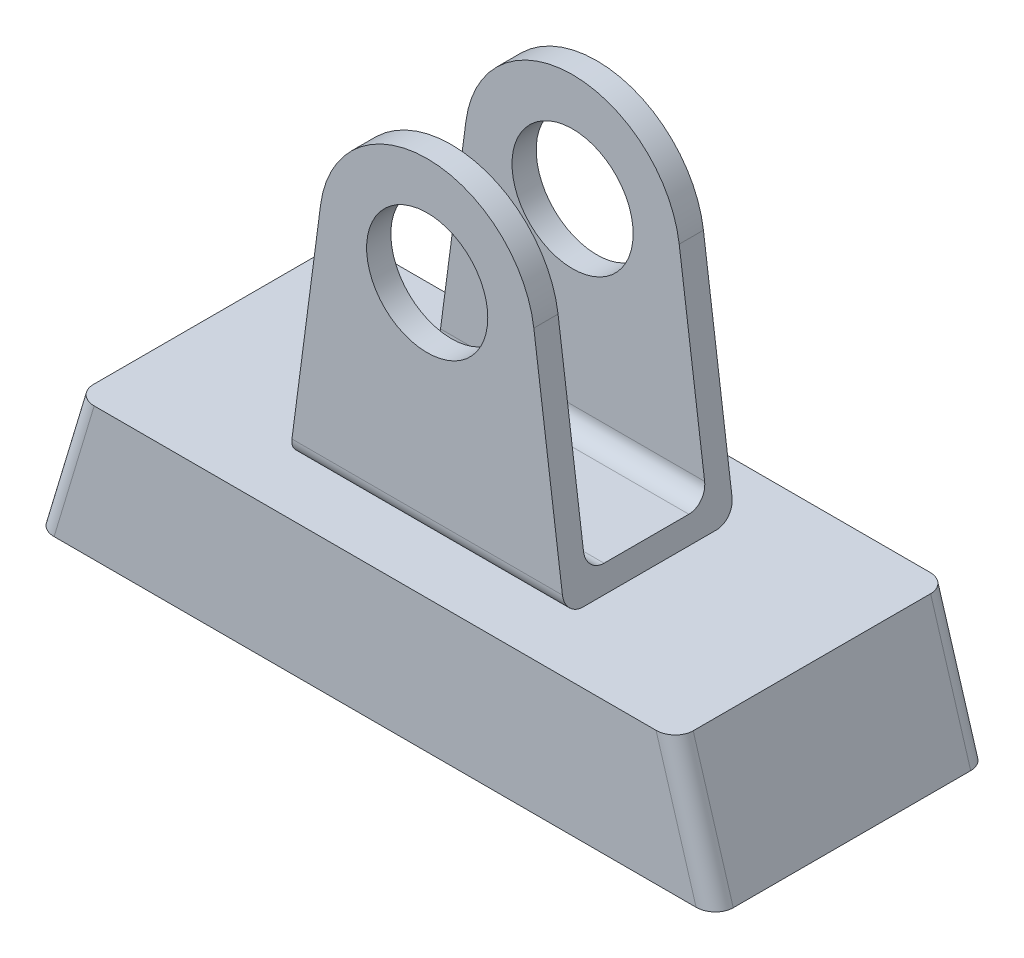
from build123d import *

# Parameters (mm, degrees)
SKETCH1_R           = 5
BOSS_EXTRUDE1_DEPTH = 2
BOSS_EXTRUDE2_DEPTH = 10
LPATTERN1_COUNT     = 2
LPATTERN1_PITCH     = 12
FILLET1_R           = 1.5
SKETCH3_W           = 56.126339002
SKETCH3_H           = 22.59818153
BOSS_EXTRUDE3_DEPTH = 11
CUT_EXTRUDE1_DEPTH  = 47.406488284
SHELL1_START        = -14.299090765
SHELL1_DEPTH        = 18.59818153
FILLET2_R           = 1.5
SKETCH6_W           = 1.5
SKETCH6_H           = 18.59818153
BOSS_EXTRUDE4_DEPTH = 2


# Read off the part's stored shape, not the designer's step: Shell1
with BuildPart() as part:
    # Sketch1 → Boss-Extrude1 (new body)
    with BuildSketch(Plane.XY):
        with BuildLine():
            Line((-11.361776574, -18.246245298), (-8.801388784, 1.161153468))
            ThreePointArc((-8.801388784, 1.161153468), (0, 8.87765295), (8.801388784, 1.161153468))
            Line((8.801388784, 1.161153468), (11.361776574, -18.246245298))
            Line((11.361776574, -18.246245298), (-11.361776574, -18.246245298))
        make_face()
        Circle(SKETCH1_R, mode=Mode.SUBTRACT)
    boss_extrude1 = extrude(amount=BOSS_EXTRUDE1_DEPTH)

    # Sketch2 → Boss-Extrude2 (add)
    with BuildSketch(Plane(origin=(0, 0, 0), x_dir=(-1, 0, 0), z_dir=(0, 0, -1))):
        Polygon((-11.0979197, -16.246245298), (11.0979197, -16.246245298), (11.361776574, -18.246245298), (-11.361776574, -18.246245298), align=None)
    extrude(amount=BOSS_EXTRUDE2_DEPTH)

    # LPattern1: Boss-Extrude1 ×2
    with Locations(*[(0, 0, -i * LPATTERN1_PITCH) for i in range(1, LPATTERN1_COUNT)]):
        add(boss_extrude1)

    # Fillet1
    fillet1_edges = [part.edges().sort_by_distance(p)[0] for p in [
        (0, -18.246245298, -12),
        (0, -16.246245298, 0),
        (0, -16.246245298, -10),
        (0, -18.246245298, 2),
    ]]
    fillet(fillet1_edges, radius=FILLET1_R)

    # Sketch3 → Boss-Extrude3 (add)
    with BuildSketch(Plane.XZ.offset(18.246245298)):
        with Locations((0, -5)):
            Rectangle(SKETCH3_W, SKETCH3_H)
    extrude(amount=BOSS_EXTRUDE3_DEPTH)

    # Sketch5 → Cut-Extrude1 (cut, through all)
    with BuildSketch(Plane.XY.offset(6.299090765)):
        Polygon((-28.063169501, -29.246245298), (-24.755567795, -18.246245298), (-28.063169501, -18.246245298), align=None)
        Polygon((28.063169501, -18.246245298), (28.063169501, -29.246245298), (24.755567795, -18.246245298), align=None)
    extrude(amount=-CUT_EXTRUDE1_DEPTH, mode=Mode.SUBTRACT)

    # Shell1 outline → Shell1 (cut)
    with BuildSketch(Plane.XY.offset(SHELL1_START)):
        Polygon((25.974710628, -29.246245298), (25.674019564, -28.246245298), (-25.674019564, -28.246245298), (-25.974710628, -29.246245298), align=None)
    extrude(amount=SHELL1_DEPTH, mode=Mode.SUBTRACT)

    # Fillet2
    fillet2_edges = [part.edges().sort_by_distance(p)[0] for p in [
        (26.409368648, -23.746245298, -16.299090765),
        (26.409368648, -23.746245298, 6.299090765),
        (25.824365096, -28.746245298, -14.299090765),
        (-25.824365096, -28.746245298, -14.299090765),
        (-25.824365096, -28.746245298, 4.299090765),
        (25.824365096, -28.746245298, 4.299090765),
        (-26.409368648, -23.746245298, -16.299090765),
        (-26.409368648, -23.746245298, 6.299090765),
    ]]
    fillet(fillet2_edges, radius=FILLET2_R)

    # Sketch6 → Boss-Extrude4 (add)
    with BuildSketch(Plane.XZ.offset(28.246245298)):
        with Locations((23.658366473, -5)):
            Rectangle(SKETCH6_W, SKETCH6_H)
        with Locations((20.038366473, -5)):
            Rectangle(SKETCH6_W, SKETCH6_H)
        with Locations((16.418366473, -5)):
            Rectangle(SKETCH6_W, SKETCH6_H)
        with Locations((12.798366473, -5)):
            Rectangle(SKETCH6_W, SKETCH6_H)
        with Locations((9.178366473, -5)):
            Rectangle(SKETCH6_W, SKETCH6_H)
        with Locations((5.558366473, -5)):
            Rectangle(SKETCH6_W, SKETCH6_H)
        with Locations((1.938366473, -5)):
            Rectangle(SKETCH6_W, SKETCH6_H)
        with Locations((-1.681633527, -5)):
            Rectangle(SKETCH6_W, SKETCH6_H)
        with Locations((-5.301633527, -5)):
            Rectangle(SKETCH6_W, SKETCH6_H)
        with Locations((-8.921633527, -5)):
            Rectangle(SKETCH6_W, SKETCH6_H)
        with Locations((-12.541633527, -5)):
            Rectangle(SKETCH6_W, SKETCH6_H)
        with Locations((-16.161633527, -5)):
            Rectangle(SKETCH6_W, SKETCH6_H)
        with Locations((-19.781633527, -5)):
            Rectangle(SKETCH6_W, SKETCH6_H)
        with Locations((-23.401633527, -5)):
            Rectangle(SKETCH6_W, SKETCH6_H)
    extrude(amount=BOSS_EXTRUDE4_DEPTH)


solid = part.part
